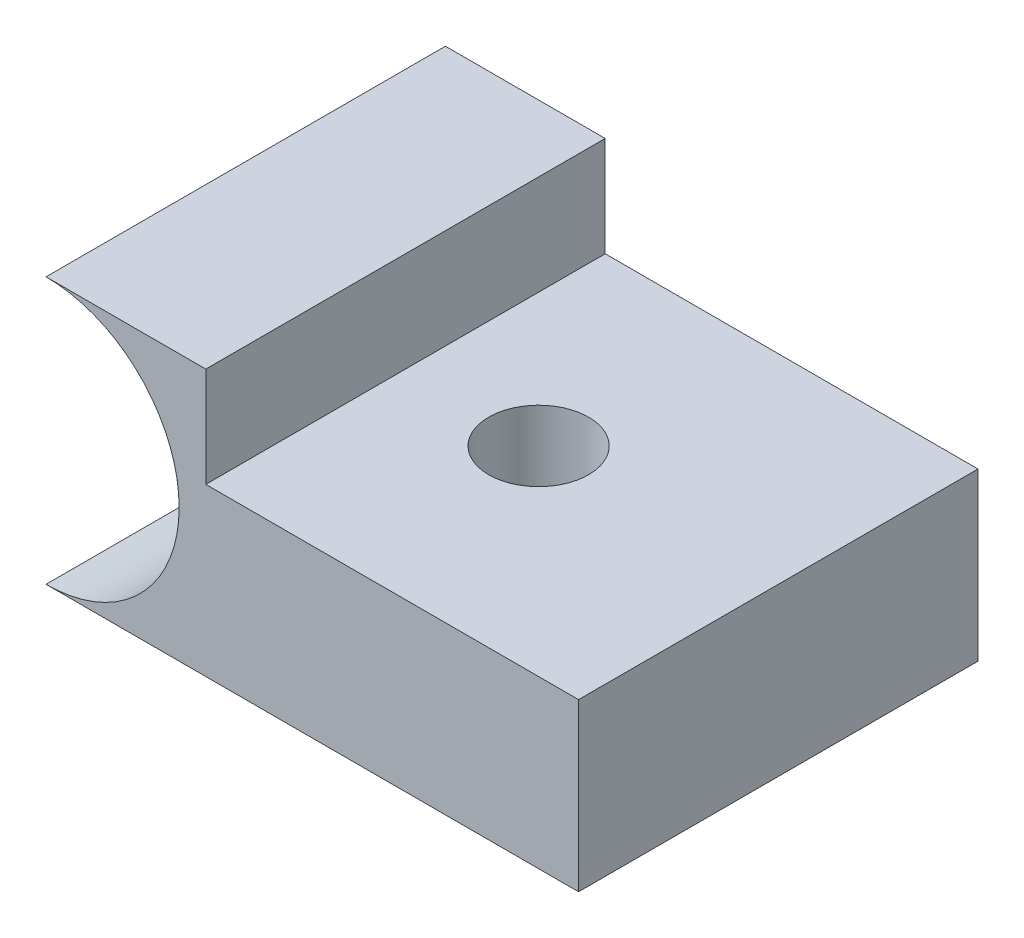
from build123d import *

# Parameters (mm, degrees)
BOSS_EXTRUDE1_DEPTH          = 38.1
F_3_8_0_375_DIAMETER_HOLE1_D = 9.525


with BuildPart() as part:
    # Sketch1 → Boss-Extrude1 (new body)
    with BuildSketch(Plane.XY):
        with BuildLine():
            Line((0, 0), (50.8, 0))
            Line((50.8, 0), (50.8, 15.875))
            Line((50.8, 15.875), (15.24, 15.875))
            Line((15.24, 15.875), (15.24, 25.4))
            Line((15.24, 25.4), (0, 25.4))
            ThreePointArc((0, 25.4), (12.7, 12.7), (0, 0))
        make_face()
    extrude(amount=BOSS_EXTRUDE1_DEPTH)

    # 3/8 (0.375) Diameter Hole1 (through all)
    with Locations(Plane(origin=(0, 15.875, 0), x_dir=(1, 0, 0), z_dir=(0, 1, 0))):
        with Locations((27.94, -19.05)):
            Hole(F_3_8_0_375_DIAMETER_HOLE1_D / 2)


solid = part.part
